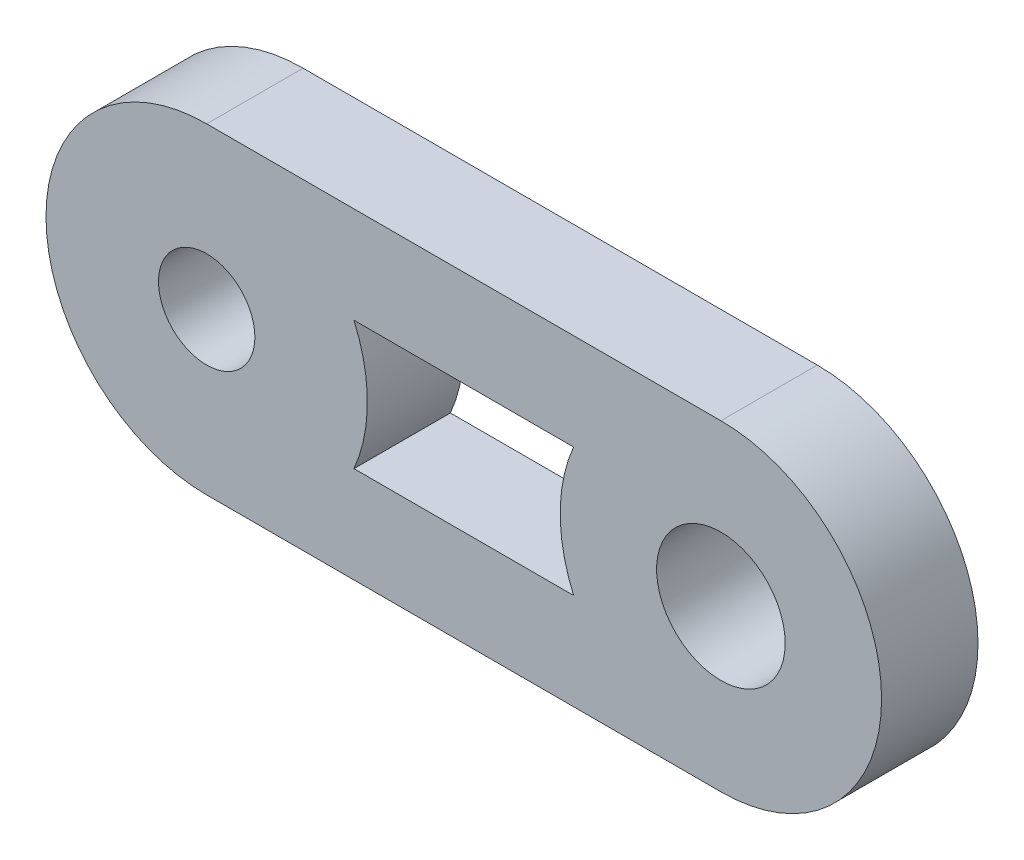
from build123d import *

# Parameters (mm, degrees)
SKETCH1_R          = 1.5
EXTRUDE1_DEPTH     = 3
CUT_EXTRUDE1_START = -10
SKETCH2_R          = 2
CUT_EXTRUDE1_DEPTH = 10


with BuildPart() as part:
    # Sketch1 → Extrude1 (new body)
    with BuildSketch(Plane.XY):
        with BuildLine():
            ThreePointArc((0, 5), (-5, 0), (0, -5))
            Line((0, -5), (16, -5))
            ThreePointArc((16, -5), (21, 0), (16, 5))
            Line((16, 5), (0, 5))
        make_face()
        Circle(SKETCH1_R, mode=Mode.SUBTRACT)
        with BuildLine():
            ThreePointArc((17.5, 0), (16, -1.5), (14.5, 0))
            ThreePointArc((14.5, 0), (16, 1.5), (17.5, 0))
        make_face(mode=Mode.SUBTRACT)
    extrude(amount=EXTRUDE1_DEPTH)

    # Sketch2 → Cut-Extrude1 (cut)
    with BuildSketch(Plane.XY.offset(3).offset(CUT_EXTRUDE1_START)):
        with Locations((16, 0)):
            Circle(SKETCH2_R)
        with BuildLine():
            Line((4.582575695, -2), (11.417424305, -2))
            ThreePointArc((11.417424305, -2), (11, 0), (11.417424305, 2))
            Line((11.417424305, 2), (4.582575695, 2))
            ThreePointArc((4.582575695, 2), (5, 0), (4.582575695, -2))
        make_face()
    extrude(amount=CUT_EXTRUDE1_DEPTH, mode=Mode.SUBTRACT)


solid = part.part
